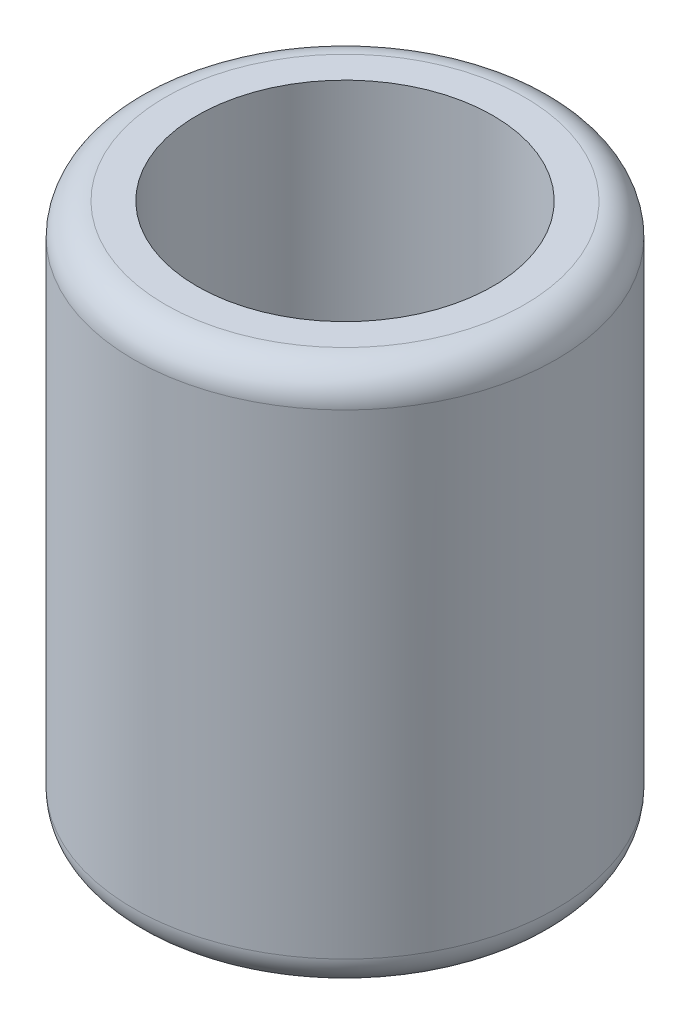
from build123d import *

# Parameters (mm, degrees)
SKETCH_1_R               = 11
SKETCH_1_R_2             = 8.1
EXTRUDE_1_DEPTH          = 11
SWEEP_2_PITCH            = 2
CUT_EXTRUDE_1_DEPTH      = 20.256876011
CUT_EXTRUDE_1_DEPTH_BACK = 20.256876011
SKETCH_8_W               = 20.965644498
SKETCH_8_H               = 3.347195004
CUT_EXTRUDE_2_DEPTH      = 1
SKETCH_1_3_R             = 20
SKETCH_1_3_R_2           = 14
EXTRUDE_2_DEPTH          = 31
SKETCH_2_R               = 20
EXTRUDE_4_DEPTH          = 20
FILLET_1_R               = 3


with BuildPart() as part:
    # 草图1 → 凸台-拉伸1 (new body)
    with BuildSketch(Plane(origin=(0, 0, 0), x_dir=(1, 0, 0), z_dir=(0, 1, 0))):
        with Locations(Location((0, 0, 0), (0, 0, 270))):
            Circle(SKETCH_1_R)
        with Locations(Location((0, 0, 0), (0, 0, 270))):
            Circle(SKETCH_1_R_2, mode=Mode.SUBTRACT)
    extrude(amount=EXTRUDE_1_DEPTH)

    # 扫描2: the profile of 草图7 profile screwed along a right-hand helix of 5.5 turns, 10 arcs to a turn; built about Z, then put on its axis
    sweep_2_z = Axis((0, 0, 0), (0, 0, 1))
    sweep_2_corners = [(8.1003, 0, 0.35021), (8.1003, 0, -0.35021), (7.6, 0, 0)]
    with BuildLine(mode=Mode.PRIVATE) as sweep_2_profile:
        Line(sweep_2_corners[0], sweep_2_corners[1])
        Line(sweep_2_corners[1], sweep_2_corners[2])
        Line(sweep_2_corners[2], sweep_2_corners[0])
    sweep_2_cap = Face(sweep_2_profile.wire())
    sweep_2_turn_angles = [0, 18, 36, 54, 72, 90, 108, 126, 144, 162, 180, 198, 216, 234, 252, 270, 288, 306, 324, 342, 360]
    sweep_2_turn_weights = [1, 0.9510565162951535, 1, 0.9510565162951535, 1, 0.9510565162951535, 1, 0.9510565162951535, 1, 0.9510565162951535, 1, 0.9510565162951535, 1, 0.9510565162951535, 1, 0.9510565162951535, 1, 0.9510565162951535, 1, 0.9510565162951535, 1]
    sweep_2_turn_rails = [Edge.make_bspline([Vector(p[0], p[1], 0).rotate(sweep_2_z, sweep_2_turn_angles[k]) / sweep_2_turn_weights[k] + Vector(0, 0, p[2] + SWEEP_2_PITCH * sweep_2_turn_angles[k] / 360) for k in range(21)], [0, 0, 0, 1, 1, 2, 2, 3, 3, 4, 4, 5, 5, 6, 6, 7, 7, 8, 8, 9, 9, 10, 10, 10], 2, sweep_2_turn_weights) for p in sweep_2_corners]
    sweep_2_turn_sides = [Face.make_surface_from_curves(sweep_2_turn_rails[p[0]], sweep_2_turn_rails[p[1]]) for p in [(0, 1), (1, 2), (2, 0)]]
    sweep_2_last_angles = [1800, 1818, 1836, 1854, 1872, 1890, 1908, 1926, 1944, 1962, 1980]
    sweep_2_last_weights = [1, 0.9510565162951535, 1, 0.9510565162951535, 1, 0.9510565162951535, 1, 0.9510565162951535, 1, 0.9510565162951394, 1]
    sweep_2_last_rails = [Edge.make_bspline([Vector(p[0], p[1], 0).rotate(sweep_2_z, sweep_2_last_angles[k]) / sweep_2_last_weights[k] + Vector(0, 0, p[2] + SWEEP_2_PITCH * sweep_2_last_angles[k] / 360) for k in range(11)], [0, 0, 0, 1, 1, 2, 2, 3, 3, 4, 4, 5, 5, 5], 2, sweep_2_last_weights) for p in sweep_2_corners]
    sweep_2_last_sides = [Face.make_surface_from_curves(sweep_2_last_rails[p[0]], sweep_2_last_rails[p[1]]) for p in [(0, 1), (1, 2), (2, 0)]]
    sweep_2 = Plane(origin=(0, 11, 0), x_dir=(-0.7071067811865537, 0, -0.7071067811865414), z_dir=(0, -1, 0)) * Solid(Shell([*[p.moved(Location((0, 0, SWEEP_2_PITCH * i))) for i in range(5) for p in sweep_2_turn_sides], *sweep_2_last_sides, sweep_2_cap, sweep_2_cap.rotate(sweep_2_z, 1980).moved(Location((0, 0, SWEEP_2_PITCH * 1980 / 360)))]))
    add(sweep_2)

    # 草图8 → 切除-拉伸1 (cut, two sides: drawn at the far end of the back side and taken through both)
    with BuildSketch(Plane(origin=(0, 0, 0), x_dir=(-0.7071067811865536, 0, -0.7071067811865416), z_dir=(0.7071067811865416, 0, -0.7071067811865536)).offset(-CUT_EXTRUDE_1_DEPTH_BACK)):
        with Locations((0.517177751, 12.673597502)):
            Rectangle(SKETCH_8_W, SKETCH_8_H)
    extrude(amount=CUT_EXTRUDE_1_DEPTH + CUT_EXTRUDE_1_DEPTH_BACK, mode=Mode.SUBTRACT)

    # 草图9 → 切除-拉伸2 (cut)
    with BuildSketch(Plane(origin=(0, 11, 0), x_dir=(1, 0, 0), z_dir=(0, 1, 0))):
        Polygon((-5.727564928, 5.727564928), (-4.090744655, 6.349136352), (-5.001356228, 5.001356228), align=None)
    extrude(amount=-CUT_EXTRUDE_2_DEPTH, mode=Mode.SUBTRACT)



with BuildPart() as body_2:
    # 草图1<3> → 凸台-拉伸2 (new body)
    with BuildSketch(Plane(origin=(0, 0, 0), x_dir=(1, 0, 0), z_dir=(0, 1, 0))):
        with Locations(Location((0, 0, 0), (0, 0, 270))):
            Circle(SKETCH_1_3_R)
        with Locations(Location((0, 0, 0), (0, 0, 270))):
            Circle(SKETCH_1_3_R_2, mode=Mode.SUBTRACT)
    extrude(amount=EXTRUDE_2_DEPTH)


with BuildPart() as part_1:
    add(part.part)

    add(body_2.part)  # 凸台-拉伸4 merges body 2
    # 草图2 → 凸台-拉伸4 (add)
    with BuildSketch(Plane.XZ):
        with Locations(Location((0, 0, 0), (0, 0, 270))):
            Circle(SKETCH_2_R)
    extrude(amount=EXTRUDE_4_DEPTH)

    # 圆角1
    # the kernel refuses this fillet: 3 mm, written as the material it takes off along each edge
    with BuildSketch(Plane(origin=(0, 31, 0), x_dir=(0, 0, 1), z_dir=(-1, 0, 0))) as fillet_1_piece_1:
        with BuildLine():
            CenterArc((20 - FILLET_1_R, -FILLET_1_R), FILLET_1_R, 0, 90)
            Line((20, -FILLET_1_R), (20, 0))
            Line((20, 0), (20 - FILLET_1_R, 0))
        make_face()
    revolve(axis=Axis((0, 31, 0), (0, 1, 0)), mode=Mode.SUBTRACT)
    with BuildSketch(Plane(origin=(0, -20, 0), x_dir=(0, 0, -1), z_dir=(-1, 0, 0))) as fillet_1_piece_2:
        with BuildLine():
            CenterArc((20 - FILLET_1_R, -FILLET_1_R), FILLET_1_R, 0, 90)
            Line((20 - FILLET_1_R, 0), (20, 0))
            Line((20, 0), (20, -FILLET_1_R))
        make_face()
    revolve(axis=Axis((0, -20, 0), (0, -1, 0)), mode=Mode.SUBTRACT)


solid = part_1.part
